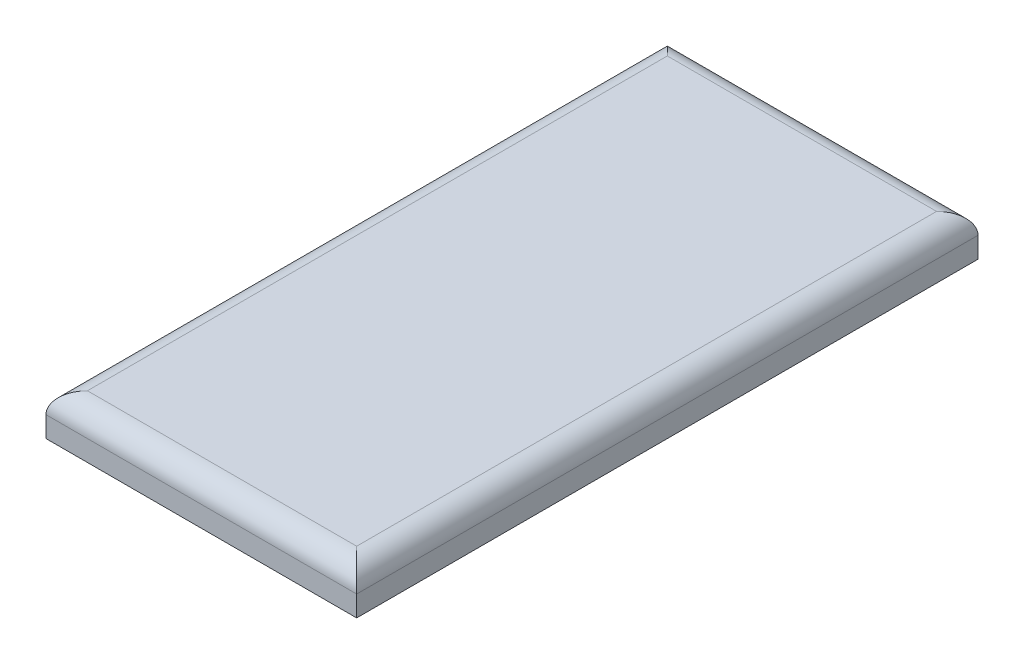
from build123d import *

# Parameters (mm, degrees)
SKETCH1_W           = 150
SKETCH1_H           = 300
BOSS_EXTRUDE1_DEPTH = 20
FILLET1_R           = 10


with BuildPart() as part:
    # Sketch1 → Boss-Extrude1 (new body)
    with BuildSketch(Plane(origin=(0, 0, 0), x_dir=(1, 0, 0), z_dir=(0, 1, 0))):
        Rectangle(SKETCH1_W, SKETCH1_H)
    extrude(amount=BOSS_EXTRUDE1_DEPTH)

    # Fillet1
    fillet1_edges = [part.edges().sort_by_distance(p)[0] for p in [
        (0, 20, 150),
        (-75, 20, 0),
        (0, 20, -150),
        (75, 20, 0),
    ]]
    fillet(fillet1_edges, radius=FILLET1_R)


solid = part.part
